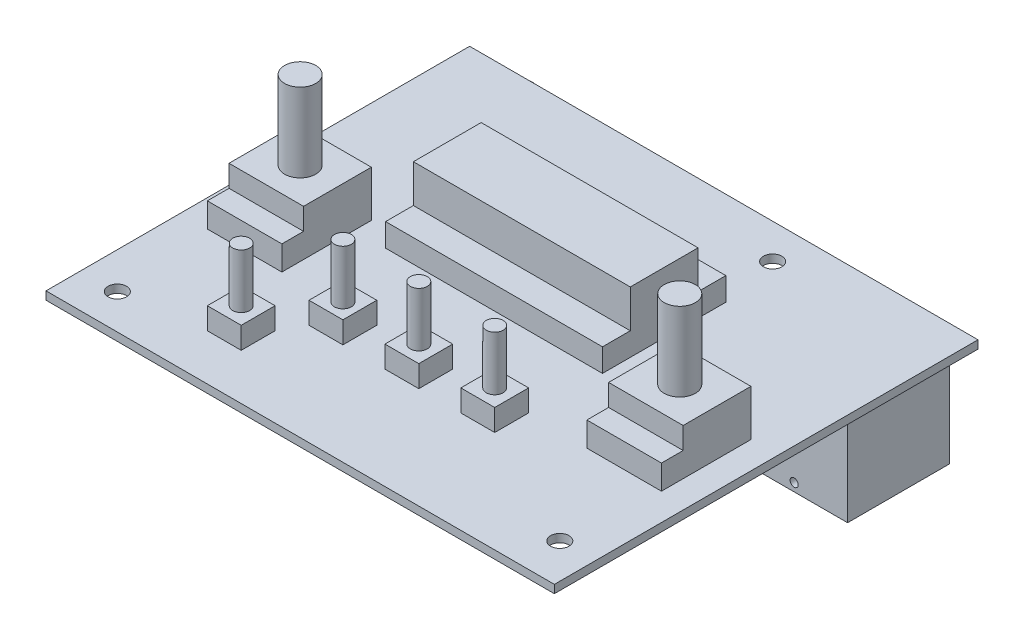
from build123d import *

# Parameters (mm, degrees)
SKETCH1_W                             = 95.25
SKETCH1_H                             = 79.375
BOSS_EXTRUDE1_DEPTH                   = 1.524
F_29_0_136_DIAMETER_HOLE1_D           = 3.4544
SKETCH4_W                             = 13.97
SKETCH4_H                             = 16.764
BOSS_EXTRUDE2_DEPTH                   = 4.572
SKETCH5_W                             = 13.97
SKETCH5_H                             = 12.7
BOSS_EXTRUDE3_DEPTH                   = 4.064
SKETCH8_W                             = 6.35
SKETCH8_H                             = 6.35
BOSS_EXTRUDE5_DEPTH                   = 4.064
SKETCH9_R                             = 1.5875
BOSS_EXTRUDE6_DEPTH                   = 10.16
SKETCH10_R                            = 2.921
BOSS_EXTRUDE7_DEPTH                   = 14.732
SKETCH11_W                            = 20.0152
SKETCH11_H                            = 21.336
BOSS_EXTRUDE8_DEPTH                   = 19.05
SKETCH12_R                            = 6.985
CUT_EXTRUDE1_DEPTH                    = 3.175
SKETCH14_W                            = 0.75565
SKETCH14_H                            = 79.375
F_53_0_0595_DIAMETER_HOLE1_AT_2_COUNT = 2
F_53_0_0595_DIAMETER_HOLE1_AT_2_PITCH = 17.4879
F_53_0_0595_DIAMETER_HOLE1_AT_3_COUNT = 2
F_53_0_0595_DIAMETER_HOLE1_AT_3_PITCH = 16.783370835
SKETCH15_W                            = 5.969
SKETCH15_H                            = 5.334
BOSS_EXTRUDE9_DEPTH                   = 13.97
SKETCH16_R                            = 2.54
SKETCH16_R_2                          = 1.778
BOSS_EXTRUDE10_DEPTH                  = 2.032
BOSS_EXTRUDE10_DRAFT                  = 9
SKETCH17_R                            = 1.778
CUT_EXTRUDE2_DEPTH                    = 12.7
SKETCH18_W                            = 40.64
SKETCH18_H                            = 23.114
BOSS_EXTRUDE11_DEPTH                  = 4.318
SKETCH19_W                            = 40.64
SKETCH19_H                            = 12.7
BOSS_EXTRUDE12_DEPTH                  = 7.112


with BuildPart() as part:
    # Sketch1 → Boss-Extrude1 (new body)
    with BuildSketch(Plane(origin=(0, 0, 0), x_dir=(1, 0, 0), z_dir=(0, 1, 0))):
        Rectangle(SKETCH1_W, SKETCH1_H)
    extrude(amount=BOSS_EXTRUDE1_DEPTH)

    # #29 (0.136) Diameter Hole1 (through all)
    with Locations(Plane(origin=(0, 1.524, 0), x_dir=(1, 0, 0), z_dir=(0, 1, 0))):
        with Locations((41.0845, -32.131), (15.6845, 33.147), (-25.5778, 22.2123), (-40.8305, -33.1216)):
            Hole(F_29_0_136_DIAMETER_HOLE1_D / 2)

    # Sketch4 → Boss-Extrude2 (add)
    with BuildSketch(Plane(origin=(0, 1.524, 0), x_dir=(1, 0, 0), z_dir=(0, 1, 0))):
        with Locations((35.56, -6.1595)):
            Rectangle(SKETCH4_W, SKETCH4_H)
        with Locations((-35.56, -6.1595)):
            Rectangle(SKETCH4_W, SKETCH4_H)
    extrude(amount=BOSS_EXTRUDE2_DEPTH)

    # Sketch5 → Boss-Extrude3 (add)
    with BuildSketch(Plane(origin=(0, 6.096, 0), x_dir=(1, 0, 0), z_dir=(0, 1, 0))):
        with Locations((-35.56, -4.1275)):
            Rectangle(SKETCH5_W, SKETCH5_H)
        with Locations((35.56, -4.1275)):
            Rectangle(SKETCH5_W, SKETCH5_H)
    extrude(amount=BOSS_EXTRUDE3_DEPTH)

    # Sketch8 → Boss-Extrude5 (add)
    with BuildSketch(Plane(origin=(0, 1.524, 0), x_dir=(1, 0, 0), z_dir=(0, 1, 0))):
        with Locations((-22.86, -27.8765)):
            Rectangle(SKETCH8_W, SKETCH8_H)
        with Locations((14.224, -17.4625)):
            Rectangle(SKETCH8_W, SKETCH8_H)
        with Locations((0, -17.4625)):
            Rectangle(SKETCH8_W, SKETCH8_H)
        with Locations((-14.224, -17.4625)):
            Rectangle(SKETCH8_W, SKETCH8_H)
    extrude(amount=BOSS_EXTRUDE5_DEPTH)

    # Sketch9 → Boss-Extrude6 (add)
    with BuildSketch(Plane(origin=(0, 5.588, 0), x_dir=(1, 0, 0), z_dir=(0, 1, 0))):
        with Locations((-13.942192497, -17.744307503)):
            Circle(SKETCH9_R)
        with Locations((0, -17.4625)):
            Circle(SKETCH9_R)
        with Locations((14.224, -17.4625)):
            Circle(SKETCH9_R)
        with Locations((-22.86, -27.8765)):
            Circle(SKETCH9_R)
    extrude(amount=BOSS_EXTRUDE6_DEPTH)

    # Sketch10 → Boss-Extrude7 (add)
    with BuildSketch(Plane(origin=(0, 10.16, 0), x_dir=(1, 0, 0), z_dir=(0, 1, 0))):
        with Locations((-35.56, -4.1275)):
            Circle(SKETCH10_R)
        with Locations((35.56, -4.1275)):
            Circle(SKETCH10_R)
    extrude(amount=BOSS_EXTRUDE7_DEPTH)

    # Sketch15 → Boss-Extrude9 (add)
    with BuildSketch(Plane(origin=(0, 0, -39.6875), x_dir=(-1, 0, 0), z_dir=(0, 0, -1))):
        with Locations((37.9095, -2.667)):
            Rectangle(SKETCH15_W, SKETCH15_H)
    extrude(amount=-BOSS_EXTRUDE9_DEPTH)


with BuildPart() as body_2:
    # Sketch11 → Boss-Extrude8 (new body)
    with BuildSketch(Plane(origin=(0, 0, -39.6875), x_dir=(-1, 0, 0), z_dir=(0, 0, -1))):
        with Locations((-32.2326, -10.668)):
            Rectangle(SKETCH11_W, SKETCH11_H)
    extrude(amount=-BOSS_EXTRUDE8_DEPTH)

    # Sketch12 → Cut-Extrude1 (cut)
    with BuildSketch(Plane(origin=(0, 0, -39.6875), x_dir=(-1, 0, 0), z_dir=(0, 0, -1))):
        with Locations((-32.2326, -10.541)):
            Circle(SKETCH12_R)
    extrude(amount=-CUT_EXTRUDE1_DEPTH, mode=Mode.SUBTRACT)

    # Sketch14 → #53 (0.0595) Diameter Hole1 (revolve, cut)
    with BuildSketch(Plane(origin=(40.97655, -5.492678114, -39.6875), x_dir=(0, 1, 0), z_dir=(1, 0, 0))):
        with Locations((0.377825, 39.6875)):
            Rectangle(SKETCH14_W, SKETCH14_H)
    f_53_0_0595_diameter_hole1 = revolve(axis=Axis((40.97655, -5.492678114, -46.0375), (0, 0, 1)), mode=Mode.SUBTRACT)

    # #53 (0.0595) Diameter Hole1 at 2: #53 (0.0595) Diameter Hole1 ×2
    with Locations(*[(-i * F_53_0_0595_DIAMETER_HOLE1_AT_2_PITCH, 0, 0) for i in range(1, F_53_0_0595_DIAMETER_HOLE1_AT_2_COUNT)]):
        add(f_53_0_0595_diameter_hole1, mode=Mode.SUBTRACT)

    # #53 (0.0595) Diameter Hole1 at 3: #53 (0.0595) Diameter Hole1 ×2
    with Locations(*[Vector(-0.5209889053752342, -0.8535634484184028, 0) * (i * F_53_0_0595_DIAMETER_HOLE1_AT_3_PITCH) for i in range(1, F_53_0_0595_DIAMETER_HOLE1_AT_3_COUNT)]):
        add(f_53_0_0595_diameter_hole1, mode=Mode.SUBTRACT)


with BuildPart() as boss_extrude10_tool:
    # Sketch16 → Boss-Extrude10 (with draft: the straight prism first)
    with BuildSketch(Plane(origin=(0, 0, -39.6875), x_dir=(-1, 0, 0), z_dir=(0, 0, -1))):
        with Locations((37.9095, -2.667)):
            Circle(SKETCH16_R)
        with Locations((37.9095, -2.667)):
            Circle(SKETCH16_R_2, mode=Mode.SUBTRACT)
    extrude(amount=BOSS_EXTRUDE10_DEPTH)
    # Boss-Extrude10: the draft: its side faces are tilted about the plane it starts from
    boss_extrude10_sides = [boss_extrude10_tool.faces().sort_by_distance(p)[0] for p in [
        (-35.3695, -2.667, -40.7035),
        (-36.1315, -2.667, -40.7035),
    ]]
    draft(boss_extrude10_sides, Plane(origin=(0, 0, -39.6875), x_dir=(-1, 0, 0), z_dir=(0, 0, -1)), BOSS_EXTRUDE10_DRAFT)


with BuildPart() as part_1:
    add(part.part)

    # Boss-Extrude10: add boss_extrude10_tool
    add(boss_extrude10_tool.part)

    # Sketch17 → Cut-Extrude2 (cut)
    with BuildSketch(Plane(origin=(0, 0, -39.6875), x_dir=(-1, 0, 0), z_dir=(0, 0, -1))):
        with Locations((37.9095, -2.667)):
            Circle(SKETCH17_R)
    extrude(amount=-CUT_EXTRUDE2_DEPTH, mode=Mode.SUBTRACT)

    # Sketch18 → Boss-Extrude11 (add)
    with BuildSketch(Plane(origin=(0, 1.524, 0), x_dir=(1, 0, 0), z_dir=(0, 1, 0))):
        with Locations((-2.413, 10.6045)):
            Rectangle(SKETCH18_W, SKETCH18_H)
    extrude(amount=BOSS_EXTRUDE11_DEPTH)

    # Sketch19 → Boss-Extrude12 (add)
    with BuildSketch(Plane(origin=(0, 5.842, 0), x_dir=(1, 0, 0), z_dir=(0, 1, 0))):
        with Locations((-2.413, 10.6045)):
            Rectangle(SKETCH19_W, SKETCH19_H)
    extrude(amount=BOSS_EXTRUDE12_DEPTH)


solid = Compound([body_2.part, part_1.part])
